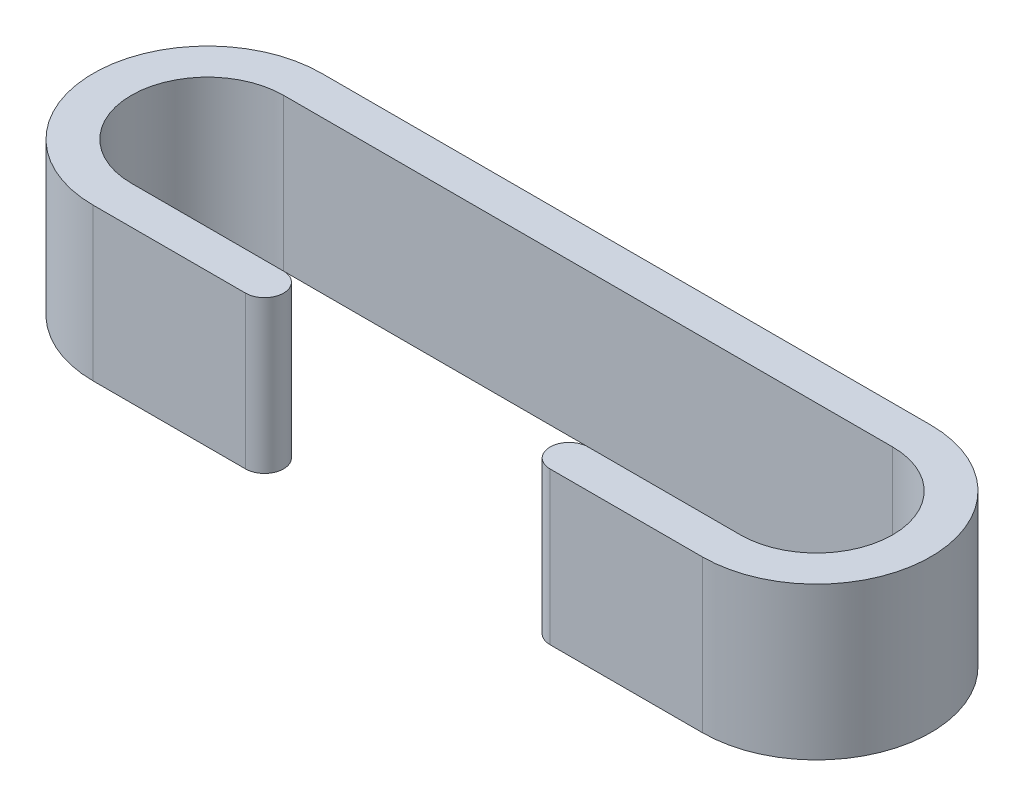
from build123d import *

# Parameters (mm, degrees)
BOSS_EXTRUDE1_DEPTH = 6.35


with BuildPart() as part:
    # Sketch1 → Boss-Extrude1 (new body)
    with BuildSketch(Plane(origin=(0, 0, 0), x_dir=(1, 0, 0), z_dir=(0, 1, 0))):
        with BuildLine():
            Line((-6.35, 0), (-12.7, 0))
            ThreePointArc((-12.7, 0), (-15.875, 3.175), (-12.7, 6.35))
            Line((-12.7, 6.35), (12.7, 6.35))
            ThreePointArc((12.7, 6.35), (15.875, 3.175), (12.7, 0))
            Line((12.7, 0), (6.35, 0))
            ThreePointArc((6.35, 0), (5.55625, -0.79375), (6.35, -1.5875))
            Line((6.35, -1.5875), (12.7, -1.5875))
            ThreePointArc((12.7, -1.5875), (17.4625, 3.175), (12.7, 7.9375))
            Line((12.7, 7.9375), (-12.7, 7.9375))
            ThreePointArc((-12.7, 7.9375), (-17.4625, 3.175), (-12.7, -1.5875))
            Line((-12.7, -1.5875), (-6.35, -1.5875))
            ThreePointArc((-6.35, -1.5875), (-5.55625, -0.79375), (-6.35, 0))
        make_face()
    extrude(amount=BOSS_EXTRUDE1_DEPTH)


solid = part.part
